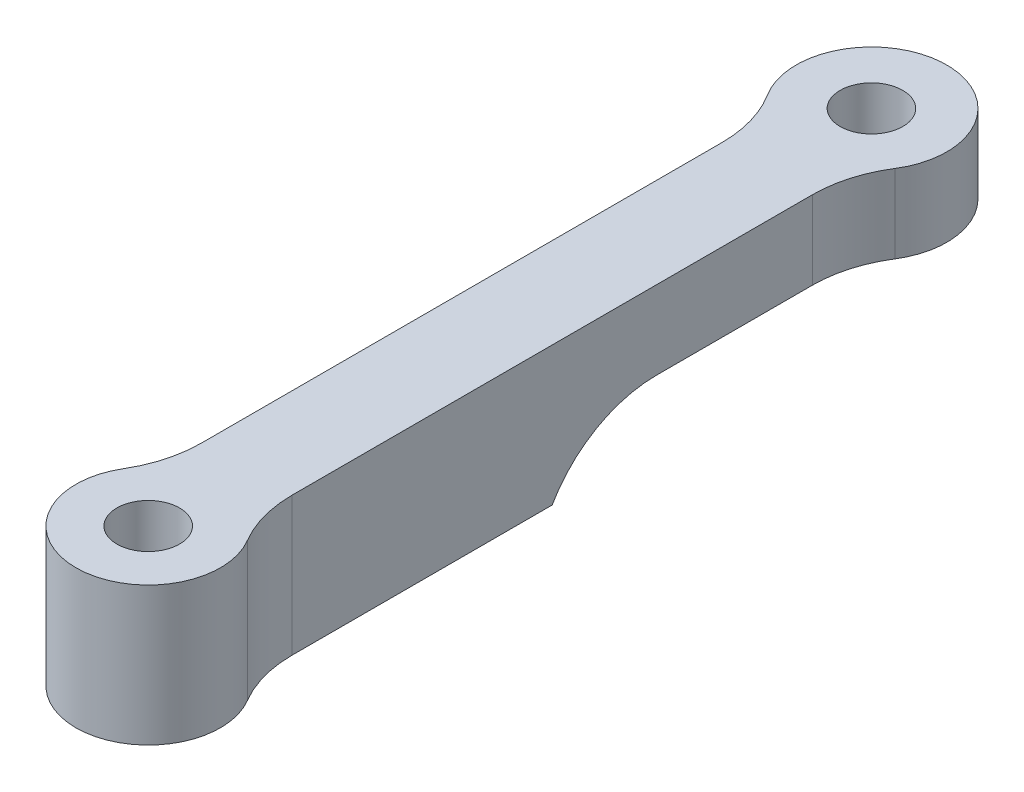
from build123d import *

# Parameters (mm, degrees)
SKETCH1_R           = 6.25
SKETCH1_R_2         = 2.6
SKETCH1_R_3         = 6
SKETCH1_W           = 7.5
SKETCH1_H           = 50.316251501
BOSS_EXTRUDE1_DEPTH = 11.5
FILLET1_R           = 10
SKETCH2_W           = 12.5
SKETCH2_H           = 36.489359976
CUT_EXTRUDE1_DEPTH  = 5
FILLET2_R           = 10


with BuildPart() as part:
    # Sketch1 → Boss-Extrude1 (new body)
    # profile 1 of 3: a face of its own
    with BuildSketch(Plane(origin=(0, 0, 0), x_dir=(1, 0, 0), z_dir=(0, 1, 0))):
        with Locations((0, 60)):
            Circle(SKETCH1_R)
        with Locations(Location((0, 60, 0), (0, 0, 270))):
            Circle(SKETCH1_R_2, mode=Mode.SUBTRACT)
    # profile 2 of 3: a face of its own
    with BuildSketch(Plane(origin=(0, 0, 0), x_dir=(1, 0, 0), z_dir=(0, 1, 0))):
        Circle(SKETCH1_R_3)
        with Locations(Location((0, 0, 0), (0, 0, 270))):
            Circle(SKETCH1_R_2, mode=Mode.SUBTRACT)
    # profile 3 of 3: a face of its own
    with BuildSketch(Plane(origin=(0, 0, 0), x_dir=(1, 0, 0), z_dir=(0, 1, 0))):
        with Locations((0, 29.84187425)):
            Rectangle(SKETCH1_W, SKETCH1_H)
    extrude(amount=BOSS_EXTRUDE1_DEPTH)

    # Fillet1
    fillet1_edges = [part.edges().sort_by_distance(p)[0] for p in [
        (-3.75, 5.75, -55),
        (3.75, 5.75, -55),
        (3.75, 5.75, -4.683748499),
        (-3.75, 5.75, -4.683748499),
    ]]
    fillet(fillet1_edges, radius=FILLET1_R)

    # Sketch2 → Cut-Extrude1 (cut)
    with BuildSketch(Plane.XZ):
        with Locations((0, -48.005320012)):
            Rectangle(SKETCH2_W, SKETCH2_H)
    extrude(amount=-CUT_EXTRUDE1_DEPTH, mode=Mode.SUBTRACT)

    # Fillet2
    # the kernel refuses this fillet: 10 mm, written as the material it adds along each edge
    with BuildSketch(Plane(origin=(-3.75, 5, -29.760640024), x_dir=(0, -1, 0), z_dir=(1, 0, 0))) as fillet2_piece_1:
        with BuildLine():
            CenterArc((10, 8.660254038), FILLET2_R, 180, 60)
            Line((0, 8.660254038), (-0.2, 8.660254038))
            Line((-0.2, 8.660254038), (-0.2, 0))
            Line((-0.2, 0), (0, -0.2))
            ThreePointArc((0, -0.2), (2.5, -0.2), (4.9, -0.173205081))
            Line((4.9, -0.173205081), (5, 0))
        make_face()
    extrude(amount=7.5)


solid = part.part
